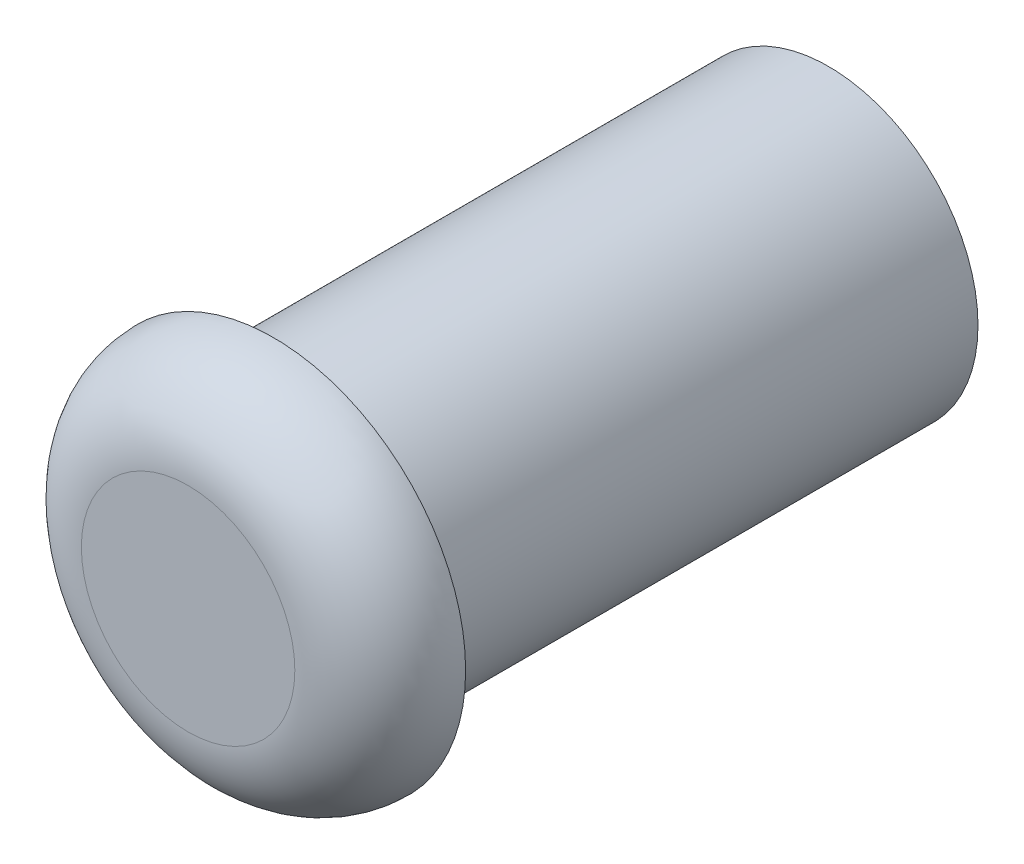
from build123d import *

# Parameters (mm, degrees)
CROQUIS1_R              = 3.5
SALIENTE_EXTRUIR1_DEPTH = 13
CROQUIS2_R              = 4.5
SALIENTE_EXTRUIR2_DEPTH = 2
REDONDEO1_R             = 2


with BuildPart() as part:
    # Croquis1 → Saliente-Extruir1 (new body)
    with BuildSketch(Plane.XY):
        with Locations(Location((0, 0, 0), (0, 0, 180))):
            Circle(CROQUIS1_R)
    extrude(amount=SALIENTE_EXTRUIR1_DEPTH)

    # Croquis2 → Saliente-Extruir2 (add)
    with BuildSketch(Plane.XY.offset(13)):
        Circle(CROQUIS2_R)
    extrude(amount=SALIENTE_EXTRUIR2_DEPTH)

    # Redondeo1
    redondeo1_edges = [part.edges().sort_by_distance(p)[0] for p in [
        (-4.5, 0, 15),
    ]]
    fillet(redondeo1_edges, radius=REDONDEO1_R - 0.0001)  # a hair under: the kernel refuses the full size


solid = part.part
